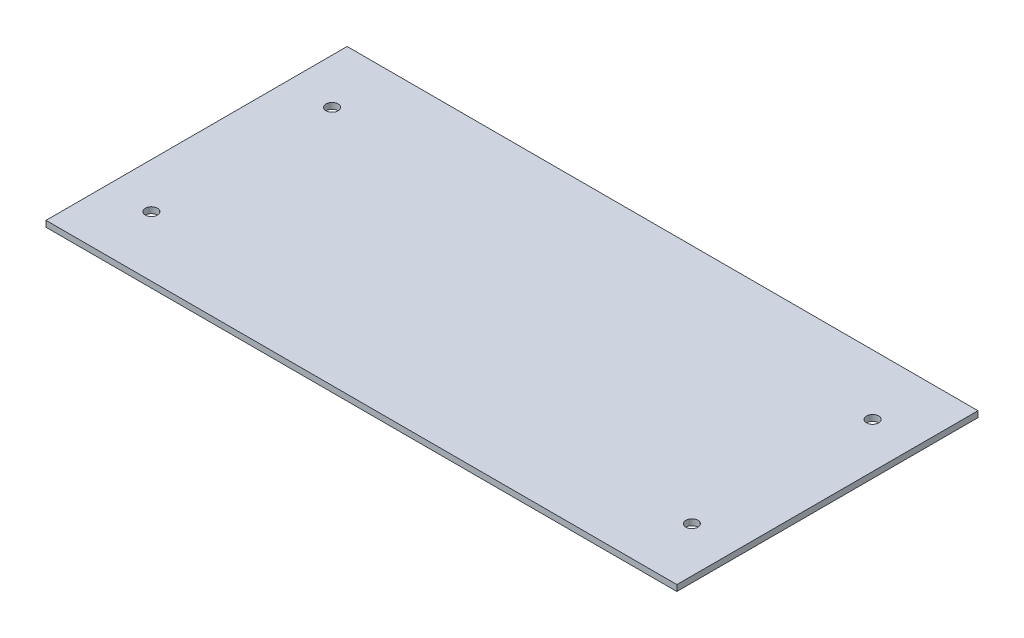
from build123d import *

# Parameters (mm, degrees)
SKETCH1_W               = 209.5
SKETCH1_H               = 100
BOSS_EXTRUDE1_DEPTH     = 2
CUT_EXTRUDE1_DEPTH      = 149.032709939
CUT_EXTRUDE1_DEPTH_BACK = 149.032709939
SKETCH2_R               = 2


with BuildPart() as part:
    # Sketch1 → Boss-Extrude1 (new body)
    with BuildSketch(Plane(origin=(0, 0, 0), x_dir=(1, 0, 0), z_dir=(0, 1, 0))):
        with Locations((27.162313362, -17.147783251)):
            Rectangle(SKETCH1_W, SKETCH1_H)
    extrude(amount=BOSS_EXTRUDE1_DEPTH)

    # Sketch2 → Cut-Extrude1 (cut, two sides: drawn at the far end of the back side and taken through both)
    with BuildSketch(Plane(origin=(0, 2, 0), x_dir=(1, 0, 0), z_dir=(0, 1, 0)).offset(-CUT_EXTRUDE1_DEPTH_BACK)):
        with Locations((-62.587686638, 12.852216749)):
            Circle(SKETCH2_R)
        with Locations((116.912313362, 12.852216749)):
            Circle(SKETCH2_R)
        with Locations((-62.587686638, -47.147783251)):
            Circle(SKETCH2_R)
        with Locations((116.912313362, -47.147783251)):
            Circle(SKETCH2_R)
    extrude(amount=CUT_EXTRUDE1_DEPTH + CUT_EXTRUDE1_DEPTH_BACK, mode=Mode.SUBTRACT)


solid = part.part
